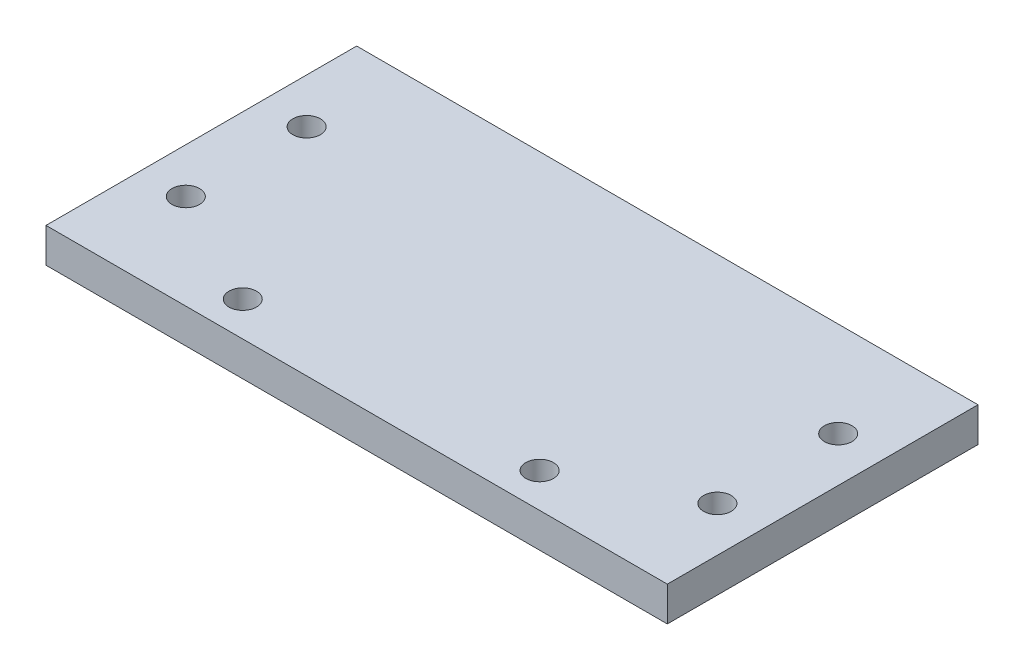
from build123d import *

# Parameters (mm, degrees)
SKETCH1_W           = 180
SKETCH1_H           = 90
SKETCH1_R           = 4
BOSS_EXTRUDE1_DEPTH = 10


with BuildPart() as part:
    # Sketch1 → Boss-Extrude1 (new body)
    with BuildSketch(Plane(origin=(0, 0, 0), x_dir=(1, 0, 0), z_dir=(0, 1, 0))):
        Rectangle(SKETCH1_W, SKETCH1_H)
        with Locations((-77, 17.5)):
            Circle(SKETCH1_R, mode=Mode.SUBTRACT)
        with Locations((-77, -17.5)):
            Circle(SKETCH1_R, mode=Mode.SUBTRACT)
        with Locations((-43, -35)):
            Circle(SKETCH1_R, mode=Mode.SUBTRACT)
        with Locations((77, 17.5)):
            Circle(SKETCH1_R, mode=Mode.SUBTRACT)
        with Locations((77, -17.5)):
            Circle(SKETCH1_R, mode=Mode.SUBTRACT)
        with Locations((43, -35)):
            Circle(SKETCH1_R, mode=Mode.SUBTRACT)
    extrude(amount=BOSS_EXTRUDE1_DEPTH)


solid = part.part
